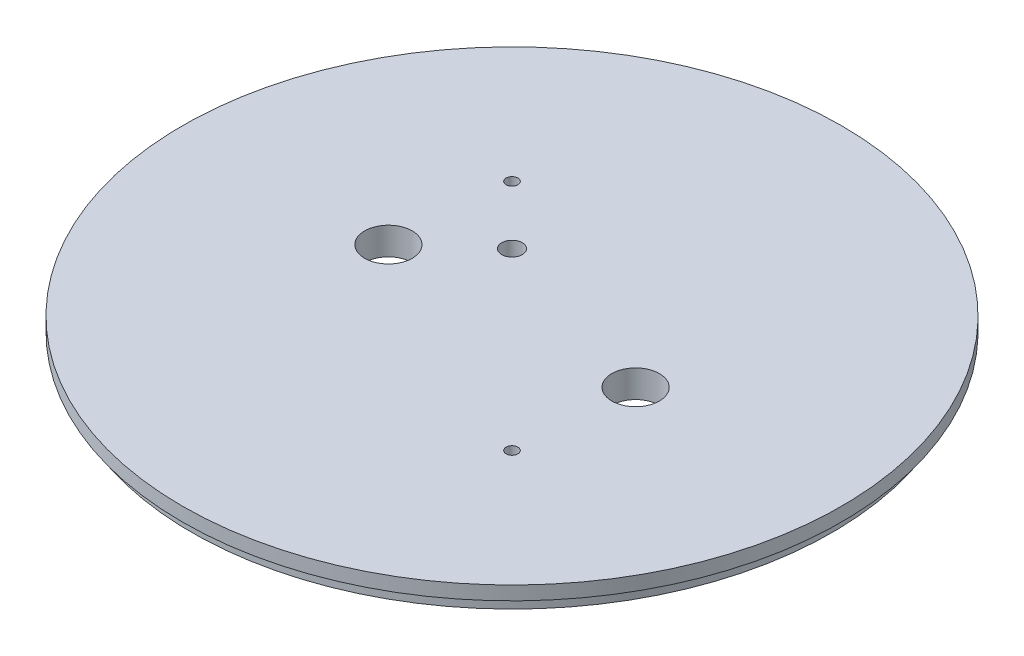
from build123d import *

# Parameters (mm, degrees)
SKETCH1_R           = 76.2
SKETCH1_R_2         = 5.500000049
SKETCH1_R_3         = 1.3589
SKETCH1_R_4         = 2.38125
BOSS_EXTRUDE1_DEPTH = 6.35
SKETCH2_R           = 76.2
SKETCH2_R_2         = 74.041
CUT_EXTRUDE1_DEPTH  = 3.175
CUT_EXTRUDE2_START  = -5.969
CUT_EXTRUDE2_DEPTH  = 3.556


with BuildPart() as part:
    # Sketch1 → Boss-Extrude1 (new body)
    with BuildSketch(Plane(origin=(0, 0, 0), x_dir=(1, 0, 0), z_dir=(0, 1, 0))):
        Circle(SKETCH1_R)
        with Locations((28.575, 0)):
            Circle(SKETCH1_R_2, mode=Mode.SUBTRACT)
        with Locations((-28.575, 0)):
            Circle(SKETCH1_R_2, mode=Mode.SUBTRACT)
        with Locations((-26.940768363, 26.940768363)):
            Circle(SKETCH1_R_3, mode=Mode.SUBTRACT)
        with Locations((26.940768363, -26.940768363)):
            Circle(SKETCH1_R_3, mode=Mode.SUBTRACT)
        with Locations((-13.470384182, 13.470384182)):
            Circle(SKETCH1_R_4, mode=Mode.SUBTRACT)
    extrude(amount=BOSS_EXTRUDE1_DEPTH)

    # Sketch2 → Cut-Extrude1 (cut)
    with BuildSketch(Plane.XZ):
        Circle(SKETCH2_R)
        Circle(SKETCH2_R_2, mode=Mode.SUBTRACT)
    extrude(amount=-CUT_EXTRUDE1_DEPTH, mode=Mode.SUBTRACT)

    # Sketch3 → Cut-Extrude2 (cut)
    with BuildSketch(Plane(origin=(0, 6.35, 0), x_dir=(1, 0, 0), z_dir=(0, 1, 0)).offset(CUT_EXTRUDE2_START)):
        with BuildLine():
            Line((3.2385, 34.798), (3.2385, 13.97))
            ThreePointArc((3.2385, 13.97), (0, 10.7315), (-3.2385, 13.97))
            Line((-3.2385, 13.97), (-3.2385, 34.798))
            ThreePointArc((-3.2385, 34.798), (0, 38.0365), (3.2385, 34.798))
        make_face()
        with BuildLine():
            Line((3.2385, -34.798), (3.2385, -13.97))
            ThreePointArc((3.2385, -13.97), (0, -10.7315), (-3.2385, -13.97))
            Line((-3.2385, -13.97), (-3.2385, -34.798))
            ThreePointArc((-3.2385, -34.798), (0, -38.0365), (3.2385, -34.798))
        make_face()
    extrude(amount=-CUT_EXTRUDE2_DEPTH, mode=Mode.SUBTRACT)


solid = part.part
